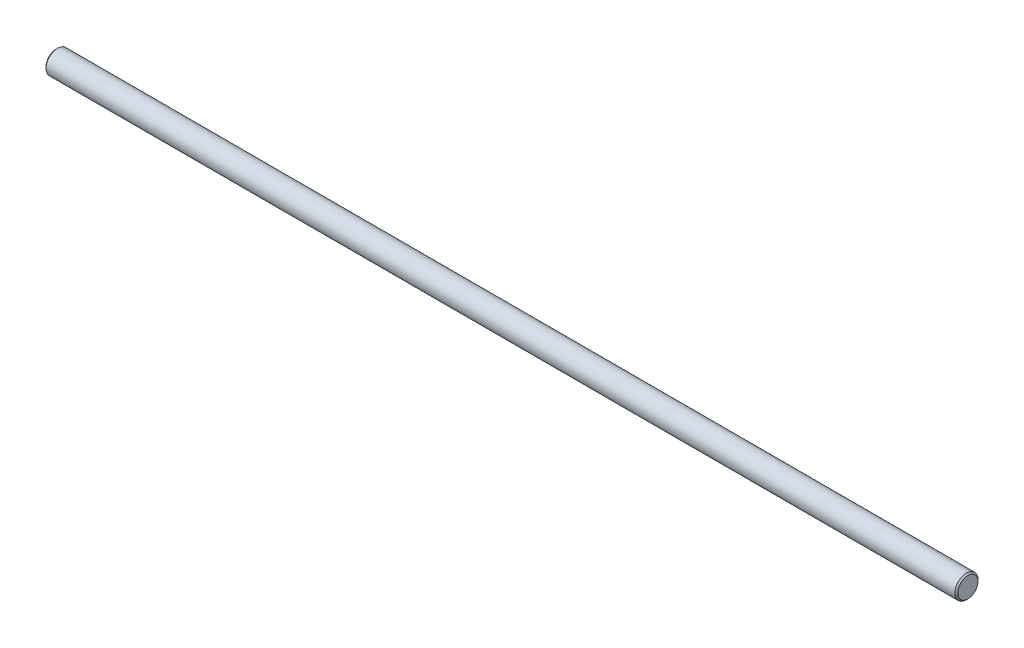
from build123d import *


with BuildPart() as part:
    # Sketch1 → Revolve1 (revolve)
    with BuildSketch(Plane.XY):
        Polygon((0, 3.5), (0, 0), (315, 0), (315, 3.5), (314.5, 4), (0.5, 4), align=None)
    revolve(axis=Axis((0, 0, 0), (1, 0, 0)))


solid = part.part
